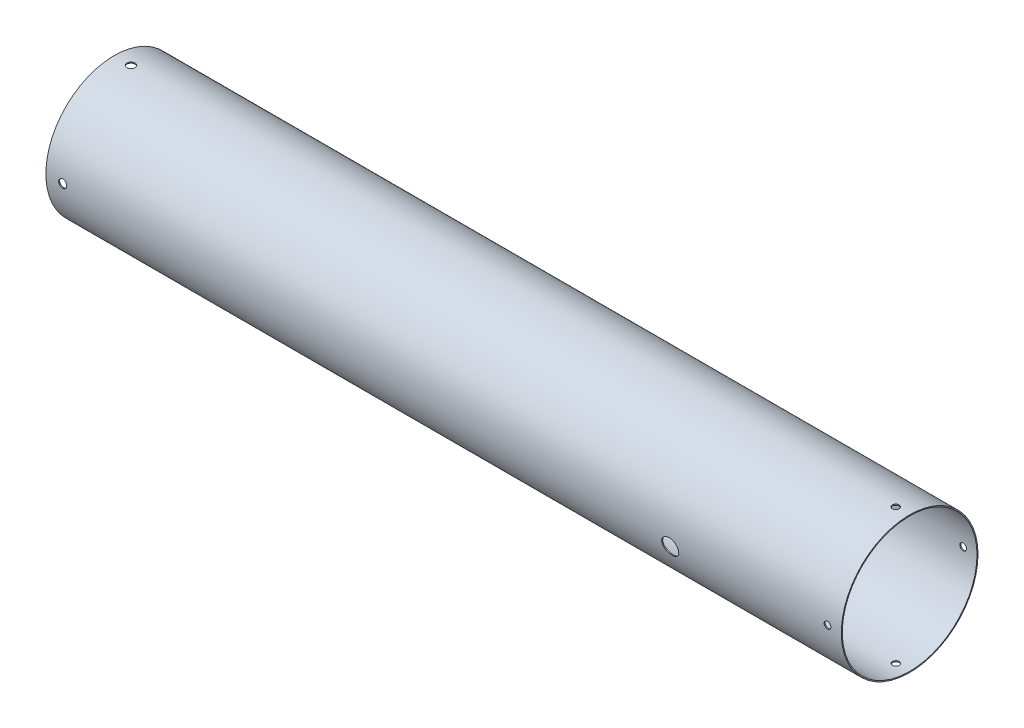
from build123d import *

# Parameters (mm, degrees)
SKETCH1_R               = 51.562
SKETCH1_R_2             = 50.8
BOSS_EXTRUDE1_DEPTH     = 300
CUT_EXTRUDE1_DEPTH      = 309.73496674
CUT_EXTRUDE1_DEPTH_BACK = 309.73496674
SKETCH3_R               = 6.35
SKETCH4_R               = 2.54
SKETCH4_R_2             = 3.048
CUT_EXTRUDE2_DEPTH      = 309.734966871
CIRPATTERN1_COUNT       = 2
CIRPATTERN1_ANGLE       = 90


with BuildPart() as part:
    # Sketch1 → Boss-Extrude1 (new, symmetric)
    with BuildSketch(Plane(origin=(0, 0, 0), x_dir=(0, 0, -1), z_dir=(1, 0, 0))):
        Circle(SKETCH1_R)
        Circle(SKETCH1_R_2, mode=Mode.SUBTRACT)
    extrude(amount=BOSS_EXTRUDE1_DEPTH, both=True)

    # Sketch3 → Cut-Extrude1 (cut, two sides: drawn at the far end of the back side and taken through both)
    with BuildSketch(Plane.XY.offset(-CUT_EXTRUDE1_DEPTH_BACK)):
        with Locations((170.180000052, -8.89)):
            Circle(SKETCH3_R)
    extrude(amount=CUT_EXTRUDE1_DEPTH + CUT_EXTRUDE1_DEPTH_BACK, mode=Mode.SUBTRACT)

    # Sketch4 → Cut-Extrude2 (cut, symmetric)
    with BuildSketch(Plane.XY):
        with Locations((289.586, 0)):
            Circle(SKETCH4_R)
        with Locations((-287.3, 0)):
            Circle(SKETCH4_R_2)
    cut_extrude2 = extrude(amount=CUT_EXTRUDE2_DEPTH, both=True, mode=Mode.SUBTRACT)

    # CirPattern1: Cut-Extrude2 ×2 about axis
    cirpattern1_axis = Axis((300, 0, 0), (-1, 0, 0))
    for i in range(1, CIRPATTERN1_COUNT):
        add(cut_extrude2.rotate(cirpattern1_axis, i * CIRPATTERN1_ANGLE / (CIRPATTERN1_COUNT - 1)), mode=Mode.SUBTRACT)


solid = part.part
